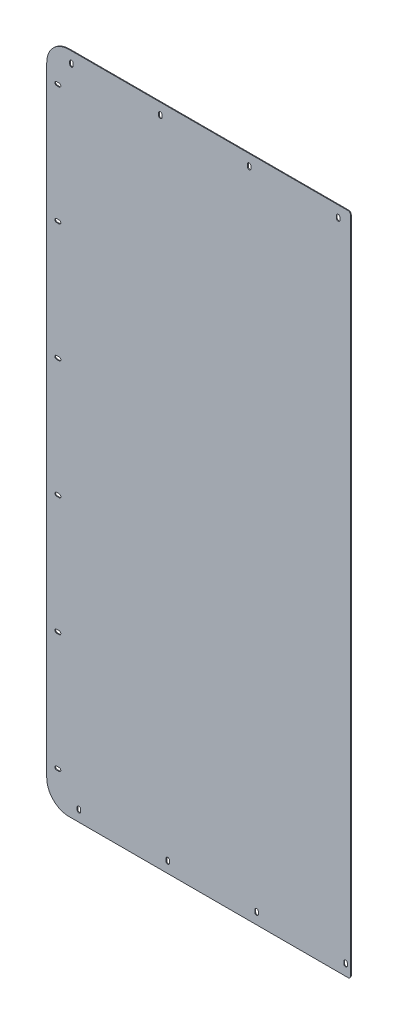
from build123d import *

# Parameters (mm, degrees)
SKETCH_1_W             = 615
SKETCH_1_H             = 1345
SM_BASE_FLANGE_1_DEPTH = 1.5
FILLET_1_R             = 45
FILLET_2_R             = 5
CUT_EXTRUDE_2_DEPTH    = 10
PATTERN_LINEAR_1_COUNT = 6
PATTERN_LINEAR_1_PITCH = 240
CUT_EXTRUDE_3_DEPTH    = 10
PATTERN_LINEAR_2_COUNT = 4
PATTERN_LINEAR_2_PITCH = 180


# Sheet-metal steps are written as plain solids
with BuildPart() as part:
    # Sketch 1 → 基体-法兰1 (new body)
    with BuildSketch(Plane.XY):
        Rectangle(SKETCH_1_W, SKETCH_1_H)
    extrude(amount=-SM_BASE_FLANGE_1_DEPTH)

    # 圆角1
    fillet_1_edges = [part.edges().sort_by_distance(p)[0] for p in [
        (-307.5, 672.5, -0.75),
        (-307.5, -672.5, -0.75),
    ]]
    fillet(fillet_1_edges, radius=FILLET_1_R)

    # 圆角2
    fillet_2_edges = [part.edges().sort_by_distance(p)[0] for p in [
        (307.5, 672.5, -0.75),
        (307.5, -672.5, -0.75),
    ]]
    fillet(fillet_2_edges, radius=FILLET_2_R)

    # 草图3 → 切除-拉伸2 (cut)
    with BuildSketch(Plane.XY):
        with BuildLine():
            Line((-287.5, -596.5), (-282.5, -596.5))
            ThreePointArc((-282.5, -596.5), (-279, -600), (-282.5, -603.5))
            Line((-282.5, -603.5), (-287.5, -603.5))
            ThreePointArc((-287.5, -603.5), (-291, -600), (-287.5, -596.5))
        make_face()
    cut_extrude_2 = extrude(amount=-CUT_EXTRUDE_2_DEPTH, mode=Mode.SUBTRACT)

    # 阵列(线性)1: 切除-拉伸2 ×6
    with Locations(*[(0, i * PATTERN_LINEAR_1_PITCH, 0) for i in range(1, PATTERN_LINEAR_1_COUNT)]):
        add(cut_extrude_2, mode=Mode.SUBTRACT)

    # 草图4 → 切除-拉伸3 (cut)
    with BuildSketch(Plane.XY):
        with BuildLine():
            Line((-261, 647.5), (-261, 652.5))
            ThreePointArc((-261, 652.5), (-257.5, 656), (-254, 652.5))
            Line((-254, 652.5), (-254, 647.5))
            ThreePointArc((-254, 647.5), (-257.5, 644), (-261, 647.5))
        make_face()
        with BuildLine():
            Line((-246, -652.5), (-246, -647.5))
            ThreePointArc((-246, -647.5), (-242.5, -644), (-239, -647.5))
            Line((-239, -647.5), (-239, -652.5))
            ThreePointArc((-239, -652.5), (-242.5, -656), (-246, -652.5))
        make_face()
    cut_extrude_3 = extrude(amount=-CUT_EXTRUDE_3_DEPTH, mode=Mode.SUBTRACT)

    # 阵列(线性)2: 切除-拉伸3 ×4
    with Locations(*[(i * PATTERN_LINEAR_2_PITCH, 0, 0) for i in range(1, PATTERN_LINEAR_2_COUNT)]):
        add(cut_extrude_3, mode=Mode.SUBTRACT)


solid = part.part
